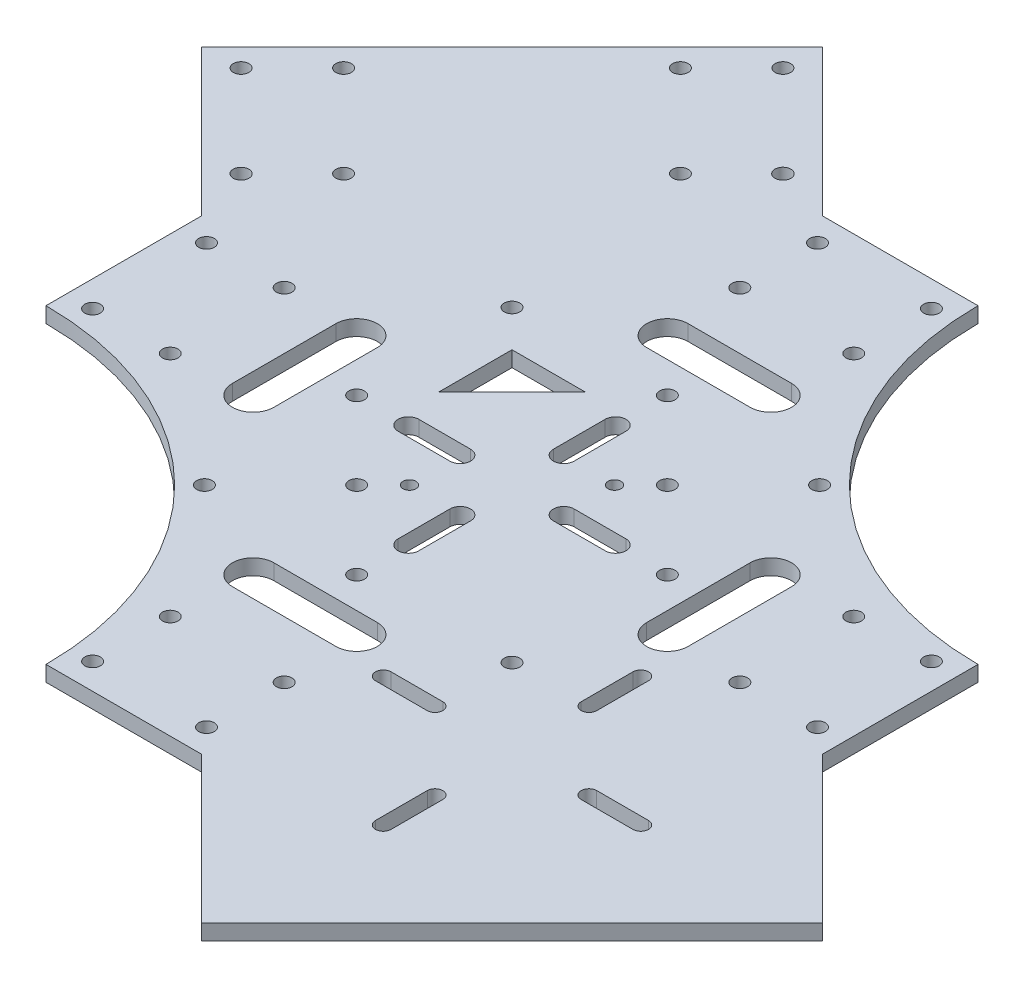
from build123d import *

# Parameters (mm, degrees)
SKETCH_1_R               = 1.25
EXTRUDE_1_DEPTH          = 3
SKETCH_2_R               = 1.5
CUT_EXTRUDE_1_DEPTH      = 3
CUT_EXTRUDE_2_DEPTH      = 3
CUT_EXTRUDE_3_DEPTH      = 3
CUT_EXTRUDE_4_DEPTH      = 10
SKETCH_6_R               = 1.5
CUT_EXTRUDE_5_DEPTH      = 10
SKETCH_7_R               = 1.5
CUT_EXTRUDE_8_DEPTH      = 10
SKETCH_8_R               = 1.5
CUT_EXTRUDE_9_DEPTH      = 10
SKETCH_9_R               = 15
CUT_EXTRUDE_10_DEPTH     = 10
SKETCH_11_R              = 1.5
EXTRUDE_3_DEPTH          = 3
CUT_EXTRUDE_12_DEPTH     = 3
EXTRUDE_4_DEPTH          = 3
SKETCH_15_R              = 15
EXTRUDE_5_DEPTH          = 3
CUT_EXTRUDE_13_DEPTH     = 3
EXTRUDE_START            = -3
EXTRUDE_7_DEPTH          = 3
CUT_EXTRUDE_14_DEPTH     = 3
CUT_EXTRUDE_15_DEPTH     = 3
PATTERN_CIRCULAR_1_COUNT = 8
SKETCH_22_R              = 1.25
CUT_EXTRUDE_17_DEPTH     = 3
SKETCH_23_R              = 1.5
CUT_EXTRUDE_18_DEPTH     = 10
SKETCH_24_R              = 1.5
CUT_EXTRUDE_19_DEPTH     = 10
CUT_EXTRUDE_START        = -10
SKETCH_25_R              = 60
CUT_EXTRUDE_20_DEPTH     = 10
EXTRUDE_8_DEPTH          = 3
EXTRUDE_10_DEPTH         = 3
SKETCH_28_R              = 1.54
SKETCH_28_R_2            = 1.52
SKETCH_28_R_3            = 1.5
CUT_EXTRUDE_21_DEPTH     = 3
SKETCH_29_R              = 1.5
CUT_EXTRUDE_22_DEPTH     = 3
EXTRUDE_11_DEPTH         = 3
SKETCH_31_R              = 1.5
CUT_EXTRUDE_23_DEPTH     = 3
EXTRUDE_12_DEPTH         = 3
CUT_EXTRUDE_24_DEPTH     = 3
EXTRUDE_13_DEPTH         = 3


with BuildPart() as part:
    # 草图1 → 凸台-拉伸1 (new body)
    with BuildSketch(Plane(origin=(0, 0, 0), x_dir=(1, 0, 0), z_dir=(0, 1, 0))):
        with BuildLine():
            Line((-75, 15), (-75, -15))
            ThreePointArc((-75, -15), (-32.573593129, -32.573593129), (-15, -75))
            Line((-15, -75), (15, -75))
            ThreePointArc((15, -75), (32.573593129, -32.573593129), (75, -15))
            Line((75, -15), (75, 15))
            ThreePointArc((75, 15), (32.573593129, 32.573593129), (15, 75))
            Line((15, 75), (-15, 75))
            ThreePointArc((-15, 75), (-32.573593129, 32.573593129), (-75, 15))
        make_face()
        with Locations((-70, 11)):
            Circle(SKETCH_1_R, mode=Mode.SUBTRACT)
        with Locations((-11, 70)):
            Circle(SKETCH_1_R, mode=Mode.SUBTRACT)
        with Locations((-70, -11)):
            Circle(SKETCH_1_R, mode=Mode.SUBTRACT)
        with Locations((-11, -70)):
            Circle(SKETCH_1_R, mode=Mode.SUBTRACT)
        with Locations((11, 70)):
            Circle(SKETCH_1_R, mode=Mode.SUBTRACT)
        with Locations((70, 11)):
            Circle(SKETCH_1_R, mode=Mode.SUBTRACT)
        with Locations((70, -11)):
            Circle(SKETCH_1_R, mode=Mode.SUBTRACT)
        with Locations((11, -70)):
            Circle(SKETCH_1_R, mode=Mode.SUBTRACT)
    extrude(amount=EXTRUDE_1_DEPTH)

    # 草图2 → 切除-拉伸1 (cut)
    with BuildSketch(Plane.XZ):
        with Locations((0.353553391, -31.466251763)):
            Circle(SKETCH_2_R)
        with Locations((31.466251763, -0.353553391)):
            Circle(SKETCH_2_R)
        with Locations((-0.353553391, 31.466251763)):
            Circle(SKETCH_2_R)
        with Locations((-31.466251763, 0.353553391)):
            Circle(SKETCH_2_R)
    extrude(amount=-CUT_EXTRUDE_1_DEPTH, mode=Mode.SUBTRACT)

    # 草图3 → 切除-拉伸2 (cut)
    with BuildSketch(Plane(origin=(0, 3, 0), x_dir=(1, 0, 0), z_dir=(0, 1, 0))):
        Polygon((-12.02081528, 19.091883092), (-22.627416998, 22.627416998), (-19.091883092, 12.02081528), align=None)
    extrude(amount=-CUT_EXTRUDE_2_DEPTH, mode=Mode.SUBTRACT)

    # 草图4 → 切除-拉伸3 (cut)
    with BuildSketch(Plane(origin=(0, 3, 0), x_dir=(1, 0, 0), z_dir=(0, 1, 0))):
        with BuildLine():
            ThreePointArc((33.944668714, -19.80253309), (34.043922781, -8.582763971), (22.827665534, -8.285032838))
            Line((22.827665534, -8.285032838), (15.556349186, -15.556349186))
            Line((15.556349186, -15.556349186), (8.285032838, -22.827665534))
            ThreePointArc((8.285032838, -22.827665534), (8.582763971, -34.043922781), (19.80253309, -33.944668714))
            Line((19.80253309, -33.944668714), (33.944668714, -19.80253309))
        make_face()
    extrude(amount=-CUT_EXTRUDE_3_DEPTH, mode=Mode.SUBTRACT)

    # 草图5 → 切除-拉伸4 (cut)
    with BuildSketch(Plane(origin=(0, 3, 0), x_dir=(1, 0, 0), z_dir=(0, 1, 0))):
        Polygon((-22.627416998, 22.627416998), (-12.02081528, 19.091883092), (-8.485281374, 22.627416998), align=None)
        Polygon((-19.091883092, 12.02081528), (-22.627416998, 22.627416998), (-22.627416998, 8.485281374), align=None)
    extrude(amount=-CUT_EXTRUDE_4_DEPTH, mode=Mode.SUBTRACT)

    # 草图6 → 切除-拉伸5 (cut)
    with BuildSketch(Plane(origin=(0, 3, 0), x_dir=(1, 0, 0), z_dir=(0, 1, 0))):
        with Locations((-35.355339059, -21.213203436)):
            Circle(SKETCH_6_R)
        with Locations((-21.213203436, -35.355339059)):
            Circle(SKETCH_6_R)
        with Locations((35.355339059, 21.213203436)):
            Circle(SKETCH_6_R)
        with Locations((21.213203436, 35.355339059)):
            Circle(SKETCH_6_R)
    extrude(amount=-CUT_EXTRUDE_5_DEPTH, mode=Mode.SUBTRACT)

    # 草图7 → 切除-拉伸8 (cut)
    with BuildSketch(Plane(origin=(0, 3, 0), x_dir=(1, 0, 0), z_dir=(0, 1, 0))):
        with Locations((-29.69848481, 29.69848481)):
            Circle(SKETCH_7_R)
        with Locations((29.69848481, 29.69848481)):
            Circle(SKETCH_7_R)
        with Locations((29.69848481, -29.69848481)):
            Circle(SKETCH_7_R)
        with Locations((-29.69848481, -29.69848481)):
            Circle(SKETCH_7_R)
    extrude(amount=-CUT_EXTRUDE_8_DEPTH, mode=Mode.SUBTRACT)

    # 草图8 → 切除-拉伸9 (cut)
    with BuildSketch(Plane(origin=(0, 3, 0), x_dir=(1, 0, 0), z_dir=(0, 1, 0))):
        with Locations((-11, 55)):
            Circle(SKETCH_8_R)
        with Locations((11, 55)):
            Circle(SKETCH_8_R)
        with Locations((55, 11)):
            Circle(SKETCH_8_R)
        with Locations((55, -11)):
            Circle(SKETCH_8_R)
        with Locations((11, -55)):
            Circle(SKETCH_8_R)
        with Locations((-11, -55)):
            Circle(SKETCH_8_R)
        with Locations((-55, -11)):
            Circle(SKETCH_8_R)
        with Locations((-55, 11)):
            Circle(SKETCH_8_R)
    extrude(amount=-CUT_EXTRUDE_9_DEPTH, mode=Mode.SUBTRACT)

    # 草图9 → 切除-拉伸10 (cut)
    with BuildSketch(Plane(origin=(0, 3, 0), x_dir=(1, 0, 0), z_dir=(0, 1, 0))):
        Circle(SKETCH_9_R)
    extrude(amount=-CUT_EXTRUDE_10_DEPTH, mode=Mode.SUBTRACT)

    # 草图11 → 凸台-拉伸3 (add)
    with BuildSketch(Plane(origin=(0, 3, 0), x_dir=(1, 0, 0), z_dir=(0, 1, 0))):
        with Locations((-35.355339059, -21.213203436)):
            Circle(SKETCH_11_R)
        with Locations((35.355339059, 21.213203436)):
            Circle(SKETCH_11_R)
        with Locations((21.213203436, 35.355339059)):
            Circle(SKETCH_11_R)
        with Locations((0.353553391, 31.466251763)):
            Circle(SKETCH_11_R)
        with Locations((31.466251763, 0.353553391)):
            Circle(SKETCH_11_R)
        with Locations((-0.353553391, -31.466251763)):
            Circle(SKETCH_11_R)
        with Locations((-31.466251763, -0.353553391)):
            Circle(SKETCH_11_R)
        with Locations((-21.213203436, -35.355339059)):
            Circle(SKETCH_11_R)
    extrude(amount=-EXTRUDE_3_DEPTH)

    # 草图12 → 切除-拉伸12 (cut)
    with BuildSketch(Plane(origin=(0, 3, 0), x_dir=(1, 0, 0), z_dir=(0, 1, 0))):
        with BuildLine():
            Line((-44, 10), (-44, -10))
            ThreePointArc((-44, -10), (-40, -14), (-36, -10))
            Line((-36, -10), (-36, 0))
            Line((-36, 0), (-36, 10))
            ThreePointArc((-36, 10), (-40, 14), (-44, 10))
        make_face()
        with BuildLine():
            Line((10, 44), (-10, 44))
            ThreePointArc((-10, 44), (-14, 40), (-10, 36))
            Line((-10, 36), (10, 36))
            ThreePointArc((10, 36), (14, 40), (10, 44))
        make_face()
        with BuildLine():
            Line((44, -10), (44, 10))
            ThreePointArc((44, 10), (40, 14), (36, 10))
            Line((36, 10), (36, -10))
            ThreePointArc((36, -10), (40, -14), (44, -10))
        make_face()
        with BuildLine():
            Line((-10, -44), (10, -44))
            ThreePointArc((10, -44), (14, -40), (10, -36))
            Line((10, -36), (-10, -36))
            ThreePointArc((-10, -36), (-14, -40), (-10, -44))
        make_face()
    extrude(amount=-CUT_EXTRUDE_12_DEPTH, mode=Mode.SUBTRACT)

    # 草图14 → 凸台-拉伸4 (add)
    with BuildSketch(Plane(origin=(0, 3, 0), x_dir=(1, 0, 0), z_dir=(0, 1, 0))):
        with BuildLine():
            ThreePointArc((8.285032838, -22.827665534), (8.582763971, -34.043922781), (19.80253309, -33.944668714))
            Line((19.80253309, -33.944668714), (33.944668714, -19.80253309))
            ThreePointArc((33.944668714, -19.80253309), (34.043922781, -8.582763971), (22.827665534, -8.285032838))
            Line((22.827665534, -8.285032838), (8.285032838, -22.827665534))
        make_face()
    extrude(amount=-EXTRUDE_4_DEPTH)

    # 草图15 → 凸台-拉伸5 (add)
    with BuildSketch(Plane(origin=(0, 3, 0), x_dir=(1, 0, 0), z_dir=(0, 1, 0))):
        Circle(SKETCH_15_R)
    extrude(amount=-EXTRUDE_5_DEPTH)

    # 草图17 → 切除-拉伸13 (cut)
    with BuildSketch(Plane(origin=(0, 3, 0), x_dir=(1, 0, 0), z_dir=(0, 1, 0))):
        with BuildLine():
            Line((-2, -20), (-2, -10))
            ThreePointArc((-2, -10), (0, -8), (2, -10))
            Line((2, -10), (2, -20))
            ThreePointArc((2, -20), (0, -22), (-2, -20))
        make_face()
        with BuildLine():
            Line((-20, 2), (-10, 2))
            ThreePointArc((-10, 2), (-8, 0), (-10, -2))
            Line((-10, -2), (-20, -2))
            ThreePointArc((-20, -2), (-22, 0), (-20, 2))
        make_face()
        with BuildLine():
            Line((2, 20), (2, 10))
            ThreePointArc((2, 10), (0, 8), (-2, 10))
            Line((-2, 10), (-2, 20))
            ThreePointArc((-2, 20), (0, 22), (2, 20))
        make_face()
        with BuildLine():
            Line((20, -2), (10, -2))
            ThreePointArc((10, -2), (8, 0), (10, 2))
            Line((10, 2), (20, 2))
            ThreePointArc((20, 2), (22, 0), (20, -2))
        make_face()
    extrude(amount=-CUT_EXTRUDE_13_DEPTH, mode=Mode.SUBTRACT)

    # 草图18 → 凸台-拉伸7 (add)
    with BuildSketch(Plane(origin=(0, 3, 0), x_dir=(1, 0, 0), z_dir=(0, 1, 0)).offset(EXTRUDE_START)):
        with BuildLine():
            ThreePointArc((-45.952273324, 22.500194525), (-32.573593129, 32.573593129), (-22.500194525, 45.952273324))
            Line((-22.500194525, 45.952273324), (-38.525223259, 61.977302058))
            ThreePointArc((-38.525223259, 61.977302058), (-89.142135624, 89.142135624), (-61.977302058, 38.525223259))
            Line((-61.977302058, 38.525223259), (-45.952273324, 22.500194525))
        make_face()
    extrude(amount=EXTRUDE_7_DEPTH)

    # 草图19 → 切除-拉伸14 (cut)
    with BuildSketch(Plane(origin=(0, 3, 0), x_dir=(1, 0, 0), z_dir=(0, 1, 0))):
        with BuildLine():
            ThreePointArc((-37.140781925, 51.282917549), (-43.180194847, 43.180194847), (-51.282917549, 37.140781925))
            Line((-51.282917549, 37.140781925), (-43.975815885, 29.833680261))
            ThreePointArc((-43.975815885, 29.833680261), (-36.109127035, 36.109127035), (-29.833680261, 43.975815885))
            Line((-29.833680261, 43.975815885), (-37.140781925, 51.282917549))
        make_face()
    extrude(amount=-CUT_EXTRUDE_14_DEPTH, mode=Mode.SUBTRACT)

    # 草图21 → 切除-拉伸15 (cut)
    with BuildSketch(Plane(origin=(0, 3, 0), x_dir=(1, 0, 0), z_dir=(0, 1, 0))):
        with BuildLine():
            ThreePointArc((-59.9739809, 61.741747853), (-60.857864376, 62.107864376), (-61.741747853, 61.741747853))
            ThreePointArc((-61.741747853, 61.741747853), (-62.107864376, 60.857864376), (-61.741747853, 59.9739809))
            Line((-61.741747853, 59.9739809), (-54.670680041, 52.902913088))
            ThreePointArc((-54.670680041, 52.902913088), (-52.902913088, 52.902913088), (-52.902913088, 54.670680041))
            Line((-52.902913088, 54.670680041), (-59.9739809, 61.741747853))
        make_face()
        with BuildLine():
            ThreePointArc((-75.883883476, 74.116116524), (-75, 73.75), (-74.116116524, 74.116116524))
            ThreePointArc((-74.116116524, 74.116116524), (-73.75, 75), (-74.116116524, 75.883883476))
            Line((-74.116116524, 75.883883476), (-81.187184335, 82.954951288))
            ThreePointArc((-81.187184335, 82.954951288), (-82.954951288, 82.954951288), (-82.954951288, 81.187184335))
            Line((-82.954951288, 81.187184335), (-75.883883476, 74.116116524))
        make_face()
    cut_extrude_15 = extrude(amount=-CUT_EXTRUDE_15_DEPTH, mode=Mode.SUBTRACT)

    # 阵列(圆周)1: 切除-拉伸15 ×8 about axis
    pattern_circular_1_axis = Axis((-67.928932188, 3, -67.928932188), (0, 1, 0))
    for i in range(1, PATTERN_CIRCULAR_1_COUNT):
        add(cut_extrude_15.rotate(pattern_circular_1_axis, i * 360 / PATTERN_CIRCULAR_1_COUNT), mode=Mode.SUBTRACT)

    # 草图22 → 切除-拉伸17 (cut)
    with BuildSketch(Plane(origin=(0, 3, 0), x_dir=(1, 0, 0), z_dir=(0, 1, 0))):
        with Locations((9.899494937, 9.899494937)):
            Circle(SKETCH_22_R)
        with Locations((-9.899494937, -9.899494937)):
            Circle(SKETCH_22_R)
    extrude(amount=-CUT_EXTRUDE_17_DEPTH, mode=Mode.SUBTRACT)

    # 草图23 → 切除-拉伸18 (cut)
    with BuildSketch(Plane(origin=(0, 3, 0), x_dir=(1, 0, 0), z_dir=(0, 1, 0))):
        with Locations((0, 30)):
            Circle(SKETCH_23_R)
        with Locations((30, 0)):
            Circle(SKETCH_23_R)
        with Locations((0, -30)):
            Circle(SKETCH_23_R)
        with Locations((-30, 0)):
            Circle(SKETCH_23_R)
    extrude(amount=-CUT_EXTRUDE_18_DEPTH, mode=Mode.SUBTRACT)

    # 草图24 → 切除-拉伸19 (cut)
    with BuildSketch(Plane(origin=(0, 3, 0), x_dir=(1, 0, 0), z_dir=(0, 1, 0))):
        with Locations((-15, -15)):
            Circle(SKETCH_24_R)
        with Locations((15, 15)):
            Circle(SKETCH_24_R)
    extrude(amount=-CUT_EXTRUDE_19_DEPTH, mode=Mode.SUBTRACT)

    # 草图25 → 切除-拉伸20 (cut)
    with BuildSketch(Plane(origin=(0, 3, 0), x_dir=(1, 0, 0), z_dir=(0, 1, 0)).offset(CUT_EXTRUDE_START)):
        with Locations((-75, 75)):
            Circle(SKETCH_25_R)
    extrude(amount=CUT_EXTRUDE_20_DEPTH, mode=Mode.SUBTRACT)

    # 草图26 → 凸台-拉伸8 (add)
    with BuildSketch(Plane(origin=(0, 3, 0), x_dir=(1, 0, 0), z_dir=(0, 1, 0)).offset(EXTRUDE_START)):
        with BuildLine():
            ThreePointArc((-75, 15), (-32.573593129, 32.573593129), (-15, 75))
            Line((-15, 75), (-75, 15))
        make_face()
    extrude(amount=EXTRUDE_8_DEPTH)

    # 草图27 → 凸台-拉伸10 (add)
    with BuildSketch(Plane.XZ):
        Polygon((-75, -15), (-89.142135624, -29.142135624), (-29.142135624, -89.142135624), (-15, -75), align=None)
    extrude(amount=-EXTRUDE_10_DEPTH)

    # 草图28 → 切除-拉伸21 (cut)
    with BuildSketch(Plane.XZ):
        with Locations((-25.908116908, -78.234018716)):
            Circle(SKETCH_28_R)
        with Locations((-78.234018716, -25.908116908)):
            Circle(SKETCH_28_R_2)
        with Locations((11, -70)):
            Circle(SKETCH_28_R_3)
        with Locations((-11, -70)):
            Circle(SKETCH_28_R_3)
        with Locations((-70, -11)):
            Circle(SKETCH_28_R_3)
        with Locations((-70, 11)):
            Circle(SKETCH_28_R_3)
        with Locations((-11, 70)):
            Circle(SKETCH_28_R_3)
        with Locations((11, 70)):
            Circle(SKETCH_28_R_3)
        with Locations((70, 11)):
            Circle(SKETCH_28_R_3)
        with Locations((70, -11)):
            Circle(SKETCH_28_R_3)
    extrude(amount=-CUT_EXTRUDE_21_DEPTH, mode=Mode.SUBTRACT)

    # 草图29 → 切除-拉伸22 (cut)
    with BuildSketch(Plane.XZ):
        with Locations((-68.334523779, -35.807611845)):
            Circle(SKETCH_29_R)
        with Locations((-35.807611845, -68.334523779)):
            Circle(SKETCH_29_R)
    extrude(amount=-CUT_EXTRUDE_22_DEPTH, mode=Mode.SUBTRACT)

    # 草图30 → 凸台-拉伸11 (add)
    with BuildSketch(Plane.XZ):
        Polygon((-29.142135624, -89.142135624), (-89.142135624, -29.142135624), (-103.284271247, -43.284271247), (-43.284271247, -103.284271247), align=None)
    extrude(amount=-EXTRUDE_11_DEPTH)

    # 草图31 → 切除-拉伸23 (cut)
    with BuildSketch(Plane.XZ):
        with Locations((-43.585786438, -95.911688245)):
            Circle(SKETCH_31_R)
        with Locations((-53.485281374, -86.012193309)):
            Circle(SKETCH_31_R)
        with Locations((-86.012193309, -53.485281374)):
            Circle(SKETCH_31_R)
        with Locations((-95.911688245, -43.585786438)):
            Circle(SKETCH_31_R)
    extrude(amount=-CUT_EXTRUDE_23_DEPTH, mode=Mode.SUBTRACT)

    # 草图32 → 凸台-拉伸12 (add)
    with BuildSketch(Plane.XZ):
        with BuildLine():
            ThreePointArc((15, 75), (32.573593129, 32.573593129), (75, 15))
            Line((75, 15), (89.142135624, 29.142135624))
            Line((89.142135624, 29.142135624), (29.142135624, 89.142135624))
            Line((29.142135624, 89.142135624), (15, 75))
        make_face()
    extrude(amount=-EXTRUDE_12_DEPTH)

    # 草图33 → 切除-拉伸24 (cut)
    with BuildSketch(Plane(origin=(0, 0, 0), x_dir=(-1, 0, 0), z_dir=(0, -1, 0))):
        with BuildLine():
            Line((-29.554853575, -42.91995823), (-19.554853575, -42.91995823))
            ThreePointArc((-19.554853575, -42.91995823), (-18.054501588, -44.420310217), (-19.554853575, -45.920662203))
            Line((-19.554853575, -45.920662203), (-29.554853575, -45.920662203))
            ThreePointArc((-29.554853575, -45.920662203), (-31.055205561, -44.420310217), (-29.554853575, -42.91995823))
        make_face()
        with BuildLine():
            Line((-42.91995823, -59.285766859), (-42.91995823, -69.285766859))
            ThreePointArc((-42.91995823, -69.285766859), (-44.420310217, -70.786118845), (-45.920662203, -69.285766859))
            Line((-45.920662203, -69.285766859), (-45.920662203, -59.285766859))
            ThreePointArc((-45.920662203, -59.285766859), (-44.420310217, -57.785414872), (-42.91995823, -59.285766859))
        make_face()
        with BuildLine():
            Line((-59.285766859, -45.920662203), (-69.285766859, -45.920662203))
            ThreePointArc((-69.285766859, -45.920662203), (-70.786118845, -44.420310217), (-69.285766859, -42.91995823))
            Line((-69.285766859, -42.91995823), (-59.285766859, -42.91995823))
            ThreePointArc((-59.285766859, -42.91995823), (-57.785414872, -44.420310217), (-59.285766859, -45.920662203))
        make_face()
        with BuildLine():
            Line((-45.920662203, -29.554853575), (-45.920662203, -19.554853575))
            ThreePointArc((-45.920662203, -19.554853575), (-44.420310217, -18.054501588), (-42.91995823, -19.554853575))
            Line((-42.91995823, -19.554853575), (-42.91995823, -29.554853575))
            ThreePointArc((-42.91995823, -29.554853575), (-44.420310217, -31.055205561), (-45.920662203, -29.554853575))
        make_face()
    extrude(amount=-CUT_EXTRUDE_24_DEPTH, mode=Mode.SUBTRACT)

    # 草图34 → 凸台-拉伸13 (add)
    with BuildSketch(Plane.XZ):
        Polygon((29.142135624, 89.142135624), (89.142135624, 29.142135624), (103.284271247, 43.284271247), (43.284271247, 103.284271247), align=None)
    extrude(amount=-EXTRUDE_13_DEPTH)


solid = part.part
